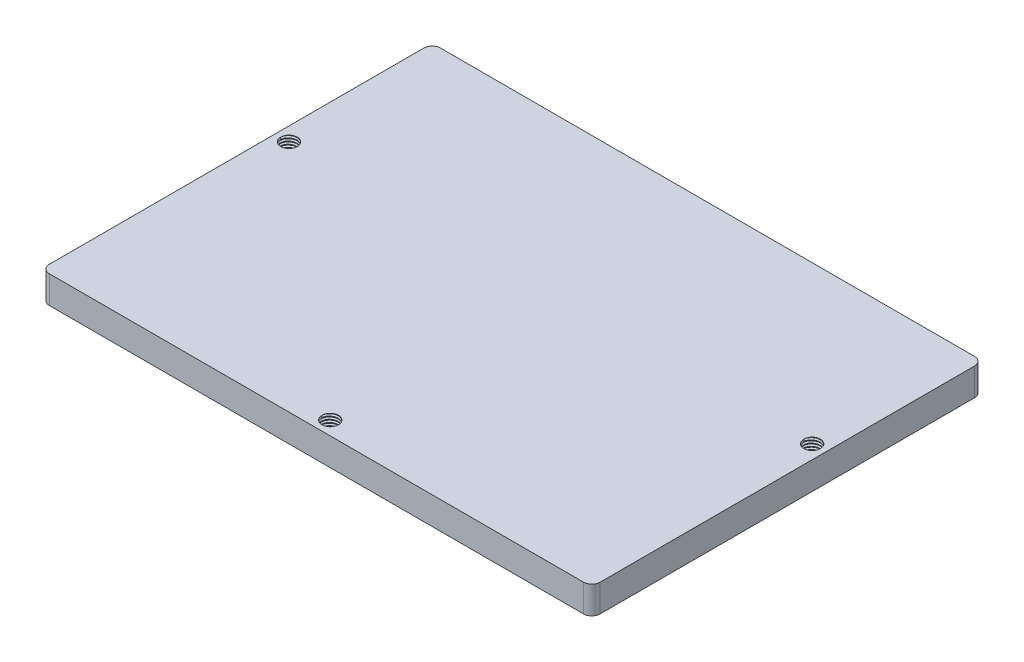
from build123d import *

# Parameters (mm, degrees)
SKETCH1_W               = 200
SKETCH1_H               = 142
BOSS_EXTRUDE1_DEPTH     = 10
FILLET1_R               = 3
ADVANCEDHOLE1_OUTLINE_R = 3
ADVANCEDHOLE1_DEPTH     = 10
THREAD1_PITCH           = 1
THREAD2_PITCH           = 1
THREAD3_PITCH           = 1


# Read off the part's stored shape, not the designer's step: AdvancedHole1
with BuildPart() as part:
    # Sketch1 → Boss-Extrude1 (new body)
    with BuildSketch(Plane(origin=(0, 0, 0), x_dir=(1, 0, 0), z_dir=(0, 1, 0))):
        with Locations((100, 71)):
            Rectangle(SKETCH1_W, SKETCH1_H)
    extrude(amount=BOSS_EXTRUDE1_DEPTH)

    # Fillet1
    fillet1_edges = [part.edges().sort_by_distance(p)[0] for p in [
        (0, 5, 0),
        (0, 5, -142),
        (200, 5, -142),
        (200, 5, 0),
    ]]
    fillet(fillet1_edges, radius=FILLET1_R)

    # AdvancedHole1 outline → AdvancedHole1 (cut)
    with BuildSketch(Plane(origin=(0, 0, 0), x_dir=(1, 0, 0), z_dir=(0, 1, 0))):
        with Locations((195, 85)):
            Circle(ADVANCEDHOLE1_OUTLINE_R)
        with Locations((100, 5)):
            Circle(ADVANCEDHOLE1_OUTLINE_R)
        with Locations((5, 85)):
            Circle(ADVANCEDHOLE1_OUTLINE_R)
    extrude(amount=ADVANCEDHOLE1_DEPTH, mode=Mode.SUBTRACT)

    # Thread1: the profile of Thread Profile1 profile screwed along a right-hand helix of 10 turns, 8 arcs to a turn; built about Z, then put on its axis
    thread1_z = Axis((0, 0, 0), (0, 0, 1))
    thread1_corners = [(2.9997, 0, -0.000173205), (3.541265875, 0, 0.312499999), (3.541265875, 0, 0.437499999), (2.9997, 0, 0.750173202)]
    with BuildLine(mode=Mode.PRIVATE) as thread1_profile:
        Line(thread1_corners[0], thread1_corners[1])
        Line(thread1_corners[1], thread1_corners[2])
        Line(thread1_corners[2], thread1_corners[3])
        Line(thread1_corners[3], thread1_corners[0])
    thread1_cap = Face(thread1_profile.wire())
    thread1_turn_angles = [0, 22.5, 45, 67.5, 90, 112.5, 135, 157.5, 180, 202.5, 225, 247.5, 270, 292.5, 315, 337.5, 360]
    thread1_turn_weights = [1, 0.9238795325112867, 1, 0.9238795325112867, 1, 0.9238795325112867, 1, 0.9238795325112867, 1, 0.9238795325112867, 1, 0.9238795325112867, 1, 0.9238795325112867, 1, 0.9238795325112867, 1]
    thread1_turn_rails = [Edge.make_bspline([Vector(p[0], p[1], 0).rotate(thread1_z, thread1_turn_angles[k]) / thread1_turn_weights[k] + Vector(0, 0, p[2] + THREAD1_PITCH * thread1_turn_angles[k] / 360) for k in range(17)], [0, 0, 0, 1, 1, 2, 2, 3, 3, 4, 4, 5, 5, 6, 6, 7, 7, 8, 8, 8], 2, thread1_turn_weights) for p in thread1_corners]
    thread1_turn_sides = [Face.make_surface_from_curves(thread1_turn_rails[p[0]], thread1_turn_rails[p[1]]) for p in [(0, 1), (1, 2), (2, 3), (3, 0)]]
    thread1 = Plane(origin=(195, 10, -85), x_dir=(-1, 0, 0), z_dir=(0, -1, 0)) * Solid(Shell([*[p.moved(Location((0, 0, THREAD1_PITCH * i))) for i in range(10) for p in thread1_turn_sides], thread1_cap, thread1_cap.rotate(thread1_z, 3600).moved(Location((0, 0, THREAD1_PITCH * 3600 / 360)))]))
    add(thread1, mode=Mode.SUBTRACT)

    # Thread2: the profile of Thread Profile2 profile screwed along a right-hand helix of 10 turns, 8 arcs to a turn; built about Z, then put on its axis
    thread2_z = Axis((0, 0, 0), (0, 0, 1))
    thread2_corners = [(2.9997, 0, -0.000173205), (3.541265875, 0, 0.312499999), (3.541265875, 0, 0.437499999), (2.9997, 0, 0.750173202)]
    with BuildLine(mode=Mode.PRIVATE) as thread2_profile:
        Line(thread2_corners[0], thread2_corners[1])
        Line(thread2_corners[1], thread2_corners[2])
        Line(thread2_corners[2], thread2_corners[3])
        Line(thread2_corners[3], thread2_corners[0])
    thread2_cap = Face(thread2_profile.wire())
    thread2_turn_angles = [0, 22.5, 45, 67.5, 90, 112.5, 135, 157.5, 180, 202.5, 225, 247.5, 270, 292.5, 315, 337.5, 360]
    thread2_turn_weights = [1, 0.9238795325112867, 1, 0.9238795325112867, 1, 0.9238795325112867, 1, 0.9238795325112867, 1, 0.9238795325112867, 1, 0.9238795325112867, 1, 0.9238795325112867, 1, 0.9238795325112867, 1]
    thread2_turn_rails = [Edge.make_bspline([Vector(p[0], p[1], 0).rotate(thread2_z, thread2_turn_angles[k]) / thread2_turn_weights[k] + Vector(0, 0, p[2] + THREAD2_PITCH * thread2_turn_angles[k] / 360) for k in range(17)], [0, 0, 0, 1, 1, 2, 2, 3, 3, 4, 4, 5, 5, 6, 6, 7, 7, 8, 8, 8], 2, thread2_turn_weights) for p in thread2_corners]
    thread2_turn_sides = [Face.make_surface_from_curves(thread2_turn_rails[p[0]], thread2_turn_rails[p[1]]) for p in [(0, 1), (1, 2), (2, 3), (3, 0)]]
    thread2 = Plane(origin=(100, 10, -5), x_dir=(-1, 0, 0), z_dir=(0, -1, 0)) * Solid(Shell([*[p.moved(Location((0, 0, THREAD2_PITCH * i))) for i in range(10) for p in thread2_turn_sides], thread2_cap, thread2_cap.rotate(thread2_z, 3600).moved(Location((0, 0, THREAD2_PITCH * 3600 / 360)))]))
    add(thread2, mode=Mode.SUBTRACT)

    # Thread3: the profile of Thread Profile3 profile screwed along a right-hand helix of 10 turns, 8 arcs to a turn; built about Z, then put on its axis
    thread3_z = Axis((0, 0, 0), (0, 0, 1))
    thread3_corners = [(2.9997, 0, -0.000173205), (3.541265875, 0, 0.312499999), (3.541265875, 0, 0.437499999), (2.9997, 0, 0.750173202)]
    with BuildLine(mode=Mode.PRIVATE) as thread3_profile:
        Line(thread3_corners[0], thread3_corners[1])
        Line(thread3_corners[1], thread3_corners[2])
        Line(thread3_corners[2], thread3_corners[3])
        Line(thread3_corners[3], thread3_corners[0])
    thread3_cap = Face(thread3_profile.wire())
    thread3_turn_angles = [0, 22.5, 45, 67.5, 90, 112.5, 135, 157.5, 180, 202.5, 225, 247.5, 270, 292.5, 315, 337.5, 360]
    thread3_turn_weights = [1, 0.9238795325112867, 1, 0.9238795325112867, 1, 0.9238795325112867, 1, 0.9238795325112867, 1, 0.9238795325112867, 1, 0.9238795325112867, 1, 0.9238795325112867, 1, 0.9238795325112867, 1]
    thread3_turn_rails = [Edge.make_bspline([Vector(p[0], p[1], 0).rotate(thread3_z, thread3_turn_angles[k]) / thread3_turn_weights[k] + Vector(0, 0, p[2] + THREAD3_PITCH * thread3_turn_angles[k] / 360) for k in range(17)], [0, 0, 0, 1, 1, 2, 2, 3, 3, 4, 4, 5, 5, 6, 6, 7, 7, 8, 8, 8], 2, thread3_turn_weights) for p in thread3_corners]
    thread3_turn_sides = [Face.make_surface_from_curves(thread3_turn_rails[p[0]], thread3_turn_rails[p[1]]) for p in [(0, 1), (1, 2), (2, 3), (3, 0)]]
    thread3 = Plane(origin=(5, 10, -85), x_dir=(-1, 0, 0), z_dir=(0, -1, 0)) * Solid(Shell([*[p.moved(Location((0, 0, THREAD3_PITCH * i))) for i in range(10) for p in thread3_turn_sides], thread3_cap, thread3_cap.rotate(thread3_z, 3600).moved(Location((0, 0, THREAD3_PITCH * 3600 / 360)))]))
    add(thread3, mode=Mode.SUBTRACT)


solid = part.part
